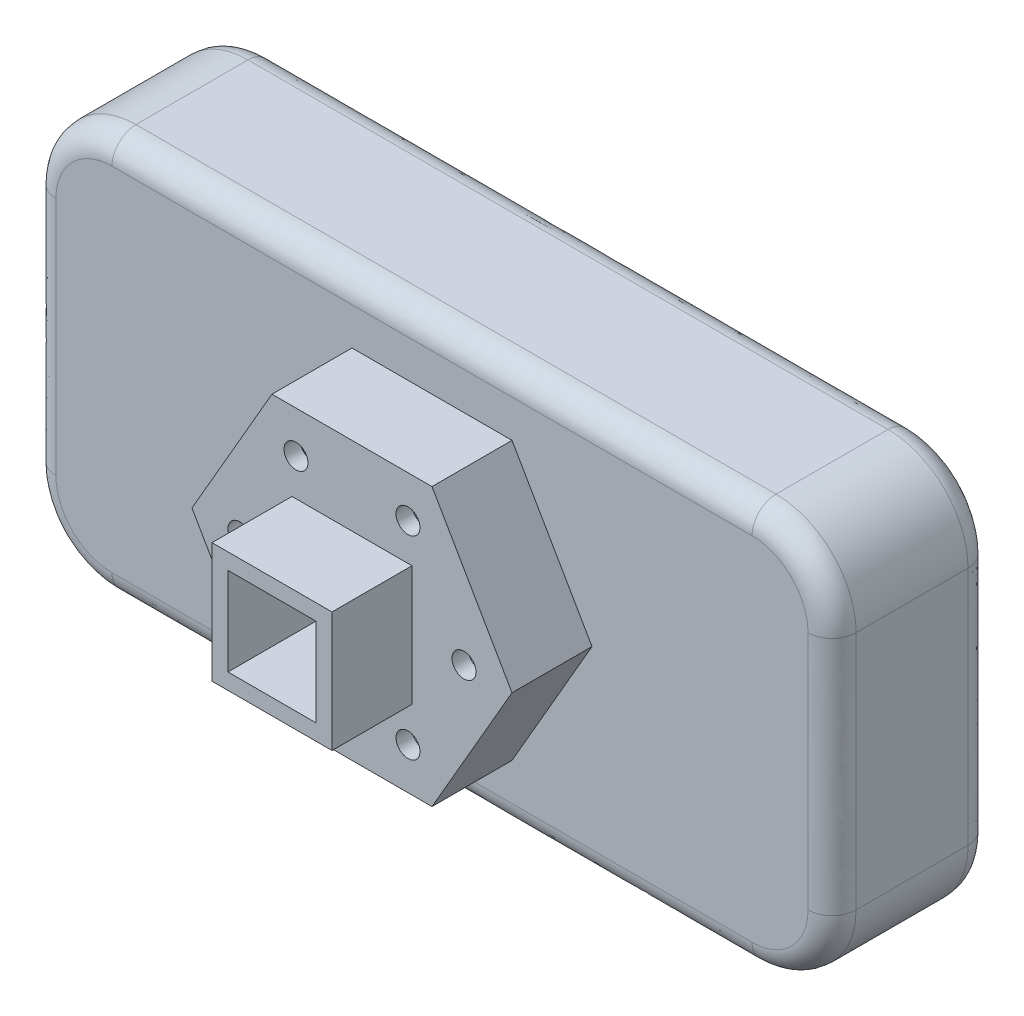
from build123d import *

# Parameters (mm, degrees)
SKETCH_2_W               = 100
SKETCH_2_H               = 50
EXTRUDE_2_DEPTH          = 20
EXTRUDE_3_DEPTH          = 10
FILLET_3_R               = 10
FILLET_4_R               = 3
SKETCH_5_W               = 15
SKETCH_5_H               = 15
EXTRUDE_4_DEPTH          = 10
SHELL_2_T                = -2
SKETCH_6_R               = 1.5
CUT_EXTRUDE_1_DEPTH      = 10
PATTERN_CIRCULAR_1_COUNT = 6


with BuildPart() as part:
    # 스케치2 → 보스-돌출2 (new body)
    with BuildSketch(Plane.XY):
        Rectangle(SKETCH_2_W, SKETCH_2_H)
    extrude(amount=EXTRUDE_2_DEPTH)

    # 스케치3 → 보스-돌출3 (add)
    with BuildSketch(Plane.XY.offset(20)):
        Polygon((20, 0), (10, 17.320508076), (-10, 17.320508076), (-20, 0), (-10, -17.320508076), (10, -17.320508076), align=None)
    extrude(amount=EXTRUDE_3_DEPTH)

    # 다중 필렛3
    fillet_3_edges = [part.edges().sort_by_distance(p)[0] for p in [
        (-50, 25, 10),
        (50, 25, 10),
        (50, -25, 10),
        (-50, -25, 10),
    ]]
    fillet(fillet_3_edges, radius=FILLET_3_R)

    # 다중 필렛4
    fillet_4_edges = [part.edges().sort_by_distance(p)[0] for p in [
        (0, 25, 0),
        (47.071067812, 22.071067812, 0),
        (50, 0, 0),
        (47.071067812, -22.071067812, 0),
        (0, -25, 0),
        (-47.071067812, -22.071067812, 0),
        (-47.071067812, 22.071067812, 0),
        (-50, 0, 0),
        (47.071067812, 22.071067812, 20),
        (47.071067812, -22.071067812, 20),
        (-47.071067812, 22.071067812, 20),
        (-47.071067812, -22.071067812, 20),
        (-50, 0, 20),
        (0, 25, 20),
        (50, 0, 20),
        (0, -25, 20),
    ]]
    fillet(fillet_4_edges, radius=FILLET_4_R)

    # 스케치5 → 보스-돌출4 (add)
    with BuildSketch(Plane.XY.offset(30)):
        Rectangle(SKETCH_5_W, SKETCH_5_H)
    extrude(amount=EXTRUDE_4_DEPTH)

    # 쉘2
    shell_2_openings = [part.faces().sort_by_distance(p)[0] for p in [
        (0, 0, 40),
    ]]
    offset(amount=SHELL_2_T, openings=shell_2_openings, kind=Kind.INTERSECTION)

    # 스케치6 → 컷-돌출1 (cut)
    with BuildSketch(Plane.XY.offset(30)):
        with Locations((-7, 12.124355653)):
            Circle(SKETCH_6_R)
    cut_extrude_1 = extrude(amount=-CUT_EXTRUDE_1_DEPTH, mode=Mode.SUBTRACT)

    # 원형 패턴1: 컷-돌출1 ×6 about axis
    pattern_circular_1_axis = Axis((0, 0, 2), (0, 0, 1))
    for i in range(1, PATTERN_CIRCULAR_1_COUNT):
        add(cut_extrude_1.rotate(pattern_circular_1_axis, i * 360 / PATTERN_CIRCULAR_1_COUNT), mode=Mode.SUBTRACT)


solid = part.part
